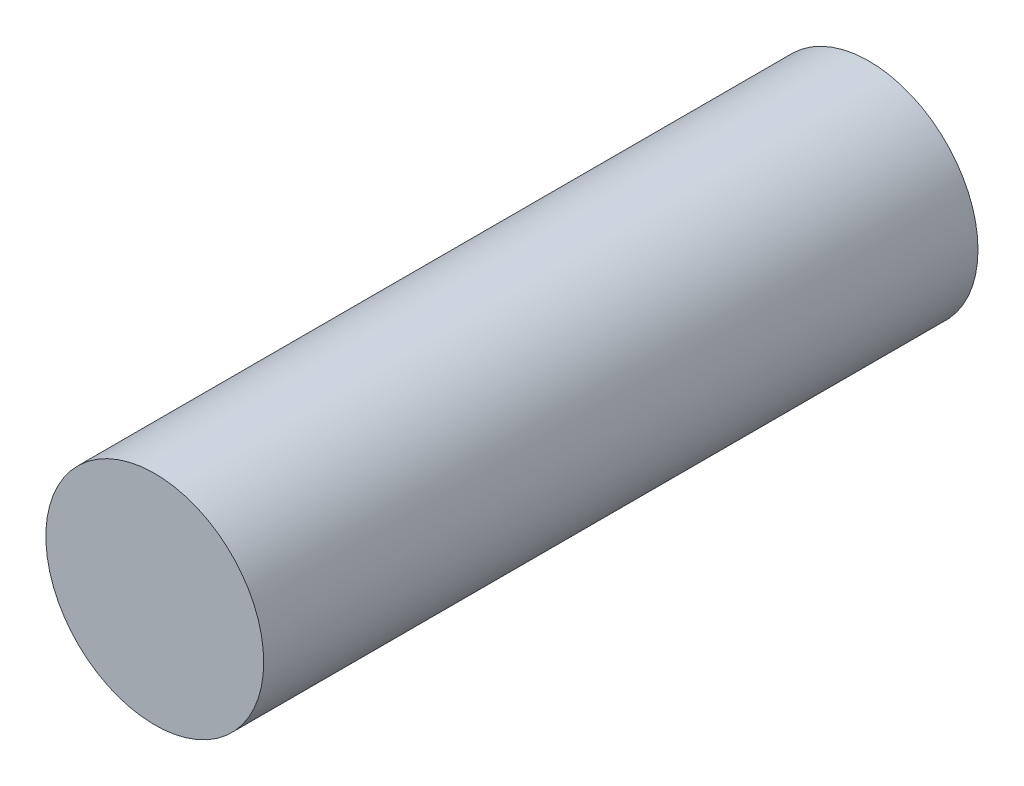
from build123d import *

# Parameters (mm, degrees)
BOSS_EXTRUDE1_DEPTH      = 3
BOSS_EXTRUDE1_DEPTH_BACK = 17
SKETCH1_R                = 3.05


with BuildPart() as part:
    # Sketch1 → Boss-Extrude1 (new, two sides: drawn at the far end of the back side and taken through both)
    with BuildSketch(Plane.XY.offset(-BOSS_EXTRUDE1_DEPTH_BACK)):
        Circle(SKETCH1_R)
    extrude(amount=BOSS_EXTRUDE1_DEPTH + BOSS_EXTRUDE1_DEPTH_BACK)


solid = part.part
